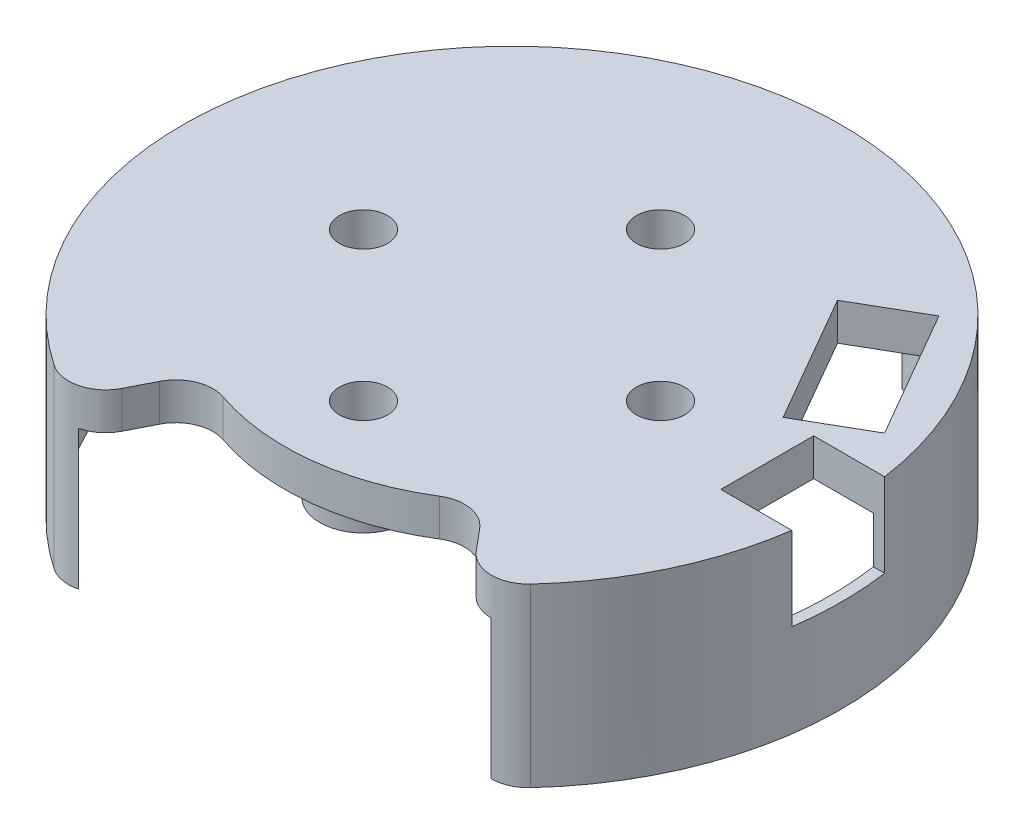
from build123d import *

# Parameters (mm, degrees)
SKETCH_1_R               = 2.35
SKETCH_1_R_2             = 1.3
EXTRUDE_1_DEPTH          = 2.5
EXTRUDE_1_2_DEPTH        = 2.5
EXTRUDE_1_3_DEPTH        = 2.5
EXTRUDE_1_4_DEPTH        = 2.5
SKETCH_2_R               = 17.75
EXTRUDE_2_DEPTH          = 2
SKETCH_3_R               = 1.3
CUT_EXTRUDE_1_DEPTH      = 26.226474189
CUT_EXTRUDE_2_DEPTH      = 26.502450863
CUT_EXTRUDE_2_DEPTH_BACK = 26.502450863
EXTRUDE_START            = 7.5
SKETCH_5_R               = 17.75
SKETCH_5_R_2             = 17.15
EXTRUDE_3_DEPTH          = 7.5
SKETCH_6_W               = 4
SKETCH_6_H               = 5
CUT_EXTRUDE_3_DEPTH      = 4.5
CUT_EXTRUDE_4_DEPTH      = 27.839802533
CUT_EXTRUDE_5_DEPTH      = 3.5
FILLET_1_R               = 2


with BuildPart() as part:
    # 草图1 → 凸台-拉伸1 (new body)
    with BuildSketch(Plane(origin=(0, 0, 0), x_dir=(1, 0, 0), z_dir=(0, 1, 0))):
        with Locations((0, 8)):
            Circle(SKETCH_1_R)
        with Locations((0, 8)):
            Circle(SKETCH_1_R_2, mode=Mode.SUBTRACT)
    extrude(amount=EXTRUDE_1_DEPTH)



with BuildPart() as body_2:
    # 草图1 → Extrude 1 2 (new body)
    with BuildSketch(Plane(origin=(0, 0, 0), x_dir=(1, 0, 0), z_dir=(0, 1, 0))):
        with Locations((8, 0)):
            Circle(SKETCH_1_R)
        with Locations((8, 0)):
            Circle(SKETCH_1_R_2, mode=Mode.SUBTRACT)
    extrude(amount=EXTRUDE_1_2_DEPTH)


with BuildPart() as body_3:
    # 草图1 → Extrude 1 3 (new body)
    with BuildSketch(Plane(origin=(0, 0, 0), x_dir=(1, 0, 0), z_dir=(0, 1, 0))):
        with Locations((0, -8)):
            Circle(SKETCH_1_R)
        with Locations((0, -8)):
            Circle(SKETCH_1_R_2, mode=Mode.SUBTRACT)
    extrude(amount=EXTRUDE_1_3_DEPTH)


with BuildPart() as body_4:
    # 草图1 → Extrude 1 4 (new body)
    with BuildSketch(Plane(origin=(0, 0, 0), x_dir=(1, 0, 0), z_dir=(0, 1, 0))):
        with Locations((-8, 0)):
            Circle(SKETCH_1_R)
        with Locations((-8, 0)):
            Circle(SKETCH_1_R_2, mode=Mode.SUBTRACT)
    extrude(amount=EXTRUDE_1_4_DEPTH)


with BuildPart() as part_1:
    add(part.part)

    add(body_2.part)  # 凸台-拉伸2 merges body 2

    add(body_3.part)  # 凸台-拉伸2 merges body 3

    add(body_4.part)  # 凸台-拉伸2 merges body 4
    # 草图2 → 凸台-拉伸2 (add)
    with BuildSketch(Plane(origin=(0, 2.5, 0), x_dir=(1, 0, 0), z_dir=(0, 1, 0))):
        Circle(SKETCH_2_R)
    extrude(amount=EXTRUDE_2_DEPTH)

    # 草图3 → 切除-拉伸1 (cut, through all)
    with BuildSketch(Plane.XZ.offset(-2.5)):
        with Locations((0, -8)):
            Circle(SKETCH_3_R)
        with Locations((8, 0)):
            Circle(SKETCH_3_R)
        with Locations((0, 8)):
            Circle(SKETCH_3_R)
        with Locations((-8, 0)):
            Circle(SKETCH_3_R)
    extrude(amount=-CUT_EXTRUDE_1_DEPTH, mode=Mode.SUBTRACT)

    # 草图4 → 切除-拉伸2 (cut, two sides: drawn at the far end of the back side and taken through both)
    with BuildSketch(Plane(origin=(0, 4.5, 0), x_dir=(1, 0, 0), z_dir=(0, 1, 0)).offset(-CUT_EXTRUDE_2_DEPTH_BACK)):
        Polygon((8.067949046, 9.464101393), (12.067949458, 2.535898401), (15.532050954, 4.535898607), (11.532050542, 11.464101599), align=None)
    extrude(amount=CUT_EXTRUDE_2_DEPTH + CUT_EXTRUDE_2_DEPTH_BACK, mode=Mode.SUBTRACT)

    # 草图5 → 凸台-拉伸3 (add)
    with BuildSketch(Plane.XZ.offset(-2.5).offset(EXTRUDE_START)):
        Circle(SKETCH_5_R)
        Circle(SKETCH_5_R_2, mode=Mode.SUBTRACT)
    extrude(amount=-EXTRUDE_3_DEPTH)

    # 草图6 → 切除-拉伸3 (cut)
    with BuildSketch(Plane(origin=(0, 4.5, 0), x_dir=(1, 0, 0), z_dir=(0, 1, 0))):
        with Locations((15.75, 0)):
            Rectangle(SKETCH_6_W, SKETCH_6_H)
    extrude(amount=-CUT_EXTRUDE_3_DEPTH, mode=Mode.SUBTRACT)

    # 草图7 → 切除-拉伸4 (cut, through all)
    with BuildSketch(Plane(origin=(0, 4.5, 0), x_dir=(1, 0, 0), z_dir=(0, 1, 0))):
        with BuildLine():
            Line((11.409480072, -13.597288865), (7.874148219, -9.384044428))
            ThreePointArc((7.874148219, -9.384044428), (1.386739369, -12.171255232), (-5.561383622, -10.914829921))
            Line((-5.561383622, -10.914829921), (-8.05833137, -15.815365804))
            ThreePointArc((-8.05833137, -15.815365804), (2.009357044, -17.635900438), (11.409480072, -13.597288865))
        make_face()
    extrude(amount=-CUT_EXTRUDE_4_DEPTH, mode=Mode.SUBTRACT)

    # 草图8 → 切除-拉伸5 (cut)
    with BuildSketch(Plane.XZ.offset(5)):
        with BuildLine():
            Line((-4.594038051, -17.145183417), (-4.438746624, -16.565627921))
            ThreePointArc((-4.438746624, -16.565627921), (0, -17.15), (4.438746624, -16.565627921))
            Line((4.438746624, -16.565627921), (4.594038051, -17.145183417))
            ThreePointArc((4.594038051, -17.145183417), (0, -17.75), (-4.594038051, -17.145183417))
        make_face()
    extrude(amount=-CUT_EXTRUDE_5_DEPTH, mode=Mode.SUBTRACT)

    # 圆角1
    fillet_1_edges = [part_1.edges().sort_by_distance(p)[0] for p in [
        (-5.561383622, 3.5, 10.914829921),
        (7.874148219, 3.5, 9.384044428),
    ]]
    fillet(fillet_1_edges, radius=FILLET_1_R)
    fillet_1_2_edges = [part_1.edges().sort_by_distance(p)[0] for p in [
        (-8.05833137, -0.25, 15.815365804),
        (11.409480072, -0.25, 13.597288865),
    ]]
    fillet(fillet_1_2_edges, radius=FILLET_1_R)


solid = part_1.part
